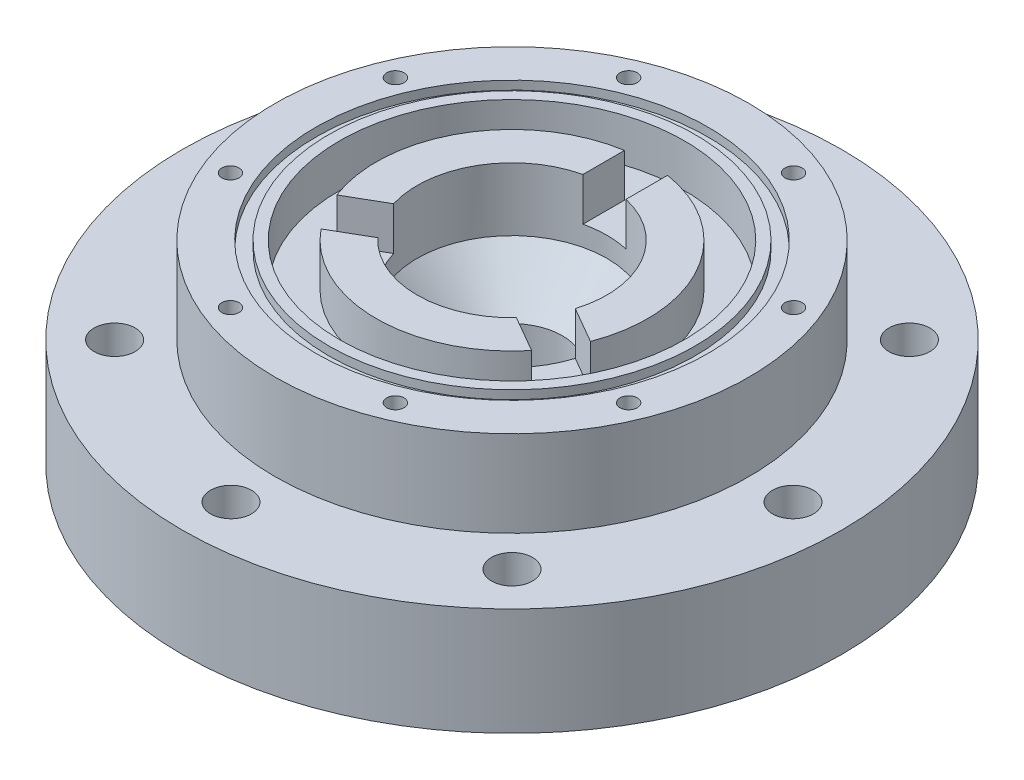
from build123d import *

# Parameters (mm, degrees)
SKETCH4_R          = 4.7625
CUT_EXTRUDE2_DEPTH = 114.707959264
CIRPATTERN1_COUNT  = 8
SKETCH6_R          = 40
SKETCH6_R_2        = 31.5
CUT_EXTRUDE3_DEPTH = 10
SKETCH7_W          = 10
SKETCH7_H          = 10.050043706
CUT_EXTRUDE4_DEPTH = 10
CIRPATTERN2_COUNT  = 3
SKETCH9_R          = 2
CUT_EXTRUDE5_DEPTH = 10
CIRPATTERN3_COUNT  = 8
SKETCH10_R         = 45.5
SKETCH10_R_2       = 42.5
CUT_EXTRUDE6_DEPTH = 2


with BuildPart() as part:
    # Sketch3 → Revolve1 (revolve)
    with BuildSketch(Plane(origin=(0, 0, 0), x_dir=(0, 0, -1), z_dir=(1, 0, 0))):
        with BuildLine():
            Line((76.5, 15), (55, 15))
            Line((55, 15), (55, 35))
            Line((55, 35), (22.025, 35))
            Line((22.025, 35), (22.025, 20.36))
            Line((22.025, 20.36), (11.665, 10))
            Line((11.665, 10), (11.665, 0))
            Line((11.665, 0), (16.665, 0))
            ThreePointArc((16.665, 0), (37.471852779, 3.234070807), (53.85, -10))
            Line((53.85, -10), (76.5, -10))
            Line((76.5, -10), (76.5, 15))
        make_face()
    revolve(axis=Axis((0, 0, 0), (0, 1, 0)))

    # Sketch4 → Cut-Extrude2 (cut, symmetric)
    with BuildSketch(Plane(origin=(0, 0, 0), x_dir=(1, 0, 0), z_dir=(0, 1, 0))):
        with Locations((-65.2, 0)):
            Circle(SKETCH4_R)
    cut_extrude2 = extrude(amount=CUT_EXTRUDE2_DEPTH, both=True, mode=Mode.SUBTRACT)

    # CirPattern1: Cut-Extrude2 ×8 about axis
    cirpattern1_axis = Axis((0, 0, 0), (0, 1, 0))
    for i in range(1, CIRPATTERN1_COUNT):
        add(cut_extrude2.rotate(cirpattern1_axis, i * 360 / CIRPATTERN1_COUNT), mode=Mode.SUBTRACT)

    # Sketch6 → Cut-Extrude3 (cut)
    with BuildSketch(Plane(origin=(0, 35, 0), x_dir=(1, 0, 0), z_dir=(0, 1, 0))):
        Circle(SKETCH6_R)
        Circle(SKETCH6_R_2, mode=Mode.SUBTRACT)
    extrude(amount=-CUT_EXTRUDE3_DEPTH, mode=Mode.SUBTRACT)

    # Sketch7 → Cut-Extrude4 (cut)
    with BuildSketch(Plane(origin=(0, 35, 0), x_dir=(1, 0, 0), z_dir=(0, 1, 0))):
        with Locations((0, 26.474978147)):
            Rectangle(SKETCH7_W, SKETCH7_H)
    cut_extrude4 = extrude(amount=-CUT_EXTRUDE4_DEPTH, mode=Mode.SUBTRACT)

    # CirPattern2: Cut-Extrude4 ×3 about axis
    cirpattern2_axis = Axis((0, 0, 0), (0, 1, 0))
    for i in range(1, CIRPATTERN2_COUNT):
        add(cut_extrude4.rotate(cirpattern2_axis, i * 360 / CIRPATTERN2_COUNT), mode=Mode.SUBTRACT)

    # Sketch9 → Cut-Extrude5 (cut)
    with BuildSketch(Plane(origin=(0, 35, 0), x_dir=(1, 0, 0), z_dir=(0, 1, 0))):
        with Locations((46.193976626, 19.134171618)):
            Circle(SKETCH9_R)
    cut_extrude5 = extrude(amount=-CUT_EXTRUDE5_DEPTH, mode=Mode.SUBTRACT)

    # CirPattern3: Cut-Extrude5 ×8 about axis
    cirpattern3_axis = Axis((0, 0, 0), (0, 1, 0))
    for i in range(1, CIRPATTERN3_COUNT):
        add(cut_extrude5.rotate(cirpattern3_axis, i * 360 / CIRPATTERN3_COUNT), mode=Mode.SUBTRACT)

    # Sketch10 → Cut-Extrude6 (cut)
    with BuildSketch(Plane(origin=(0, 35, 0), x_dir=(1, 0, 0), z_dir=(0, 1, 0))):
        Circle(SKETCH10_R)
        Circle(SKETCH10_R_2, mode=Mode.SUBTRACT)
    extrude(amount=-CUT_EXTRUDE6_DEPTH, mode=Mode.SUBTRACT)


solid = part.part
